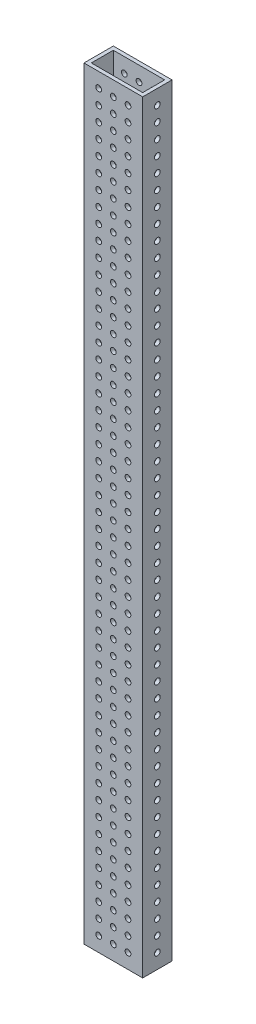
from build123d import *

# Parameters (mm, degrees)
SKETCH1_W            = 50.8
SKETCH1_H            = 25.4
SKETCH1_W_2          = 44.45
SKETCH1_H_2          = 19.05
BOSS_EXTRUDE1_DEPTH  = 330.2
SKETCH2_R            = 2.4892
CUT_EXTRUDE1_DEPTH   = 336.04901134
LPATTERN1_COUNT      = 51
LPATTERN1_PITCH      = 12.7
LPATTERN1_COUNT_DIR2 = 3
LPATTERN1_PITCH_DIR2 = 12.7
CUT_EXTRUDE2_REACH   = 337.049
SKETCH3_R            = 2.4892
LPATTERN2_COUNT      = 51
LPATTERN2_PITCH      = 12.7


with BuildPart() as part:
    # Sketch1 → Boss-Extrude1 (new, symmetric)
    with BuildSketch(Plane(origin=(0, 0, 0), x_dir=(1, 0, 0), z_dir=(0, 1, 0))):
        with Locations((25.4, 12.7)):
            Rectangle(SKETCH1_W, SKETCH1_H)
        with Locations((25.4, 12.7)):
            Rectangle(SKETCH1_W_2, SKETCH1_H_2, mode=Mode.SUBTRACT)
    extrude(amount=BOSS_EXTRUDE1_DEPTH, both=True)

    # Sketch2 → Cut-Extrude1 (cut, through all)
    with BuildSketch(Plane.XY):
        with Locations((12.7, 317.5)):
            Circle(SKETCH2_R)
    cut_extrude1 = extrude(amount=-CUT_EXTRUDE1_DEPTH, mode=Mode.SUBTRACT)

    # LPattern1: Cut-Extrude1 51 × 3
    with Locations(*[(j * LPATTERN1_PITCH_DIR2, -i * LPATTERN1_PITCH, 0) for i in range(LPATTERN1_COUNT) for j in range(LPATTERN1_COUNT_DIR2) if (i, j) != (0, 0)]):
        add(cut_extrude1, mode=Mode.SUBTRACT)

    # Sketch3 → Cut-Extrude2 (cut, up to next)
    with BuildSketch(Plane(origin=(50.8, 0, 0), x_dir=(0, 0, -1), z_dir=(1, 0, 0)), mode=Mode.PRIVATE) as cut_extrude2_sk1:
        with Locations((12.7, 317.5)):
            Circle(SKETCH3_R)
    cut_extrude2_tool1 = extrude(cut_extrude2_sk1.sketch, amount=-CUT_EXTRUDE2_REACH, mode=Mode.PRIVATE) & part.part
    cut_extrude2 = cut_extrude2_tool1.solids().sort_by_distance((50.8, 317.5, -12.7))[0]
    add(cut_extrude2, mode=Mode.SUBTRACT)

    # LPattern2: Cut-Extrude2 ×51
    with Locations(*[(0, -i * LPATTERN2_PITCH, 0) for i in range(1, LPATTERN2_COUNT)]):
        add(cut_extrude2, mode=Mode.SUBTRACT)


solid = part.part
